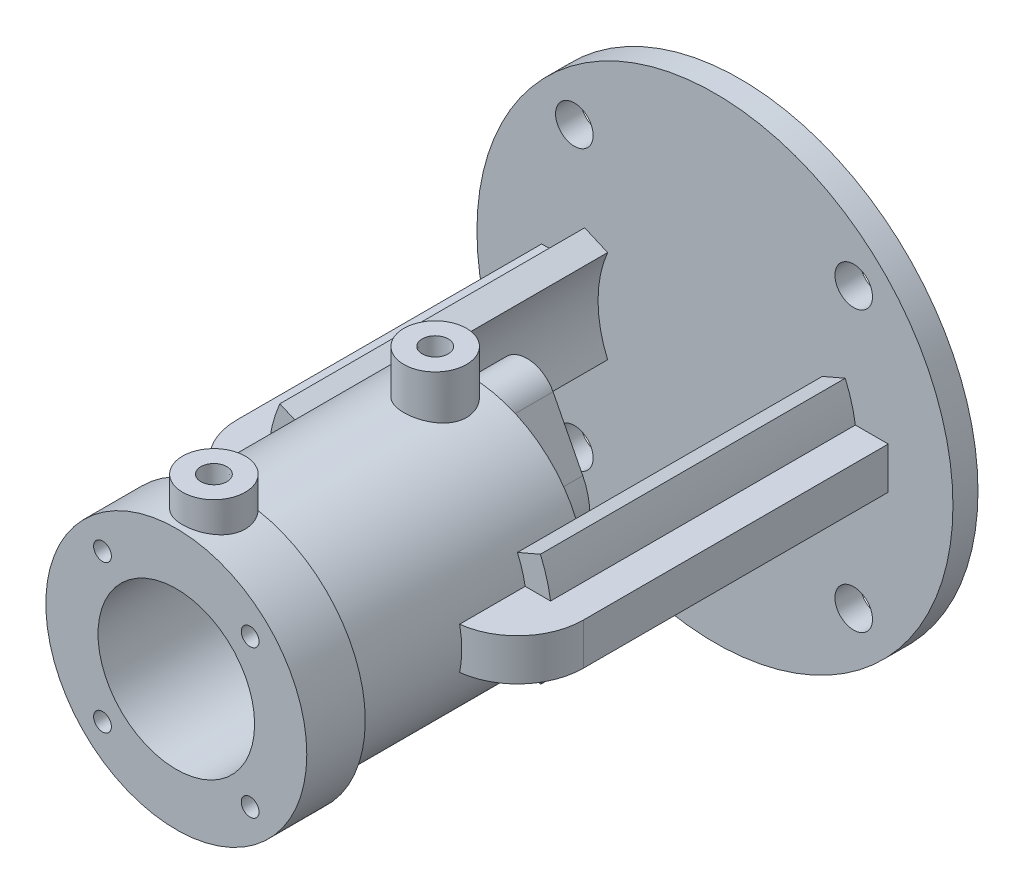
from build123d import *

# Parameters (mm, degrees)
SKETCH_1_R               = 114
EXTRUDE_1_DEPTH          = 12
EXTRUDE_START            = 258
SKETCH_2_R               = 62.5
EXTRUDE_2_DEPTH          = 28
SKETCH_3_R               = 56
EXTRUDE_3_DEPTH          = 112
SKETCH_4_R               = 30
EXTRUDE_4_DEPTH          = 28
EXTRUDE_5_REACH          = 234.843
EXTRUDE_6_DEPTH          = 118
EXTRUDE_18_DEPTH         = 28
EXTRUDE_19_DEPTH         = 10
SKETCH_12_R              = 15
EXTRUDE_20_DEPTH         = 76
SKETCH_13_R              = 15
EXTRUDE_21_DEPTH         = 76
SKETCH_14_R              = 9
CUT_EXTRUDE_1_DEPTH      = 305.230176103
PATTERN_CIRCULAR_1_COUNT = 4
SKETCH_15_R              = 62.5
EXTRUDE_22_DEPTH         = 3
SKETCH_16_R              = 37.5
CUT_EXTRUDE_2_DEPTH      = 128
PATTERN_CIRCULAR_2_COUNT = 4
SKETCH_19_R              = 41
CUT_EXTRUDE_3_DEPTH      = 8
SKETCH_20_R              = 15
EXTRUDE_23_DEPTH         = 3
CUT_EXTRUDE_4_REACH      = 220.852
SKETCH_21_R              = 12
SKETCH_22_R              = 18
CUT_EXTRUDE_5_DEPTH      = 28
CHAMFER_1_SIZE           = 6.92820323
CHAMFER_1_SIZE_2         = 4
F_1_4_RC_1_AT_2_COUNT    = 2
F_1_4_RC_1_AT_2_PITCH    = 106
F_5_0MM_START            = 11.779218889
F_5_0MM_1_OUTLINE_R      = 2.5
F_5_0MM_1_DEPTH          = 47.722932759
SKETCH_26_R              = 15
SKETCH_26_R_2            = 12
EXTRUDE_24_DEPTH         = 3


# Read off the part's stored shape, not the designer's step: Ø5.0mm 暗销孔1, M10 螺纹孔2
with BuildPart() as part:
    # 草图1 → 凸台-拉伸1 (new body)
    with BuildSketch(Plane.XY):
        Circle(SKETCH_1_R)
    extrude(amount=EXTRUDE_1_DEPTH)

    # 草图6 → 凸台-拉伸6 (add)
    with BuildSketch(Plane.XY.offset(12)):
        with BuildLine():
            Line((51.396417147, 22.235294118), (62.409935107, 27))
            ThreePointArc((62.409935107, 27), (65.390118151, 18.658307753), (67.260686883, 10))
            Line((67.260686883, 10), (83, 10))
            Line((83, 10), (83, -10))
            Line((83, -10), (67.260686883, -10))
            ThreePointArc((67.260686883, -10), (65.390118151, -18.658307753), (62.409935107, -27))
            Line((62.409935107, -27), (51.396417147, -22.235294118))
            ThreePointArc((51.396417147, -22.235294118), (56, 0), (51.396417147, 22.235294118))
        make_face()
    extrude_6 = extrude(amount=EXTRUDE_6_DEPTH)



with BuildPart() as body_2:
    # 草图2 → 凸台-拉伸2 (new body)
    with BuildSketch(Plane.XY.offset(12).offset(EXTRUDE_START)):
        Circle(SKETCH_2_R)
    extrude(amount=-EXTRUDE_2_DEPTH)

    # 草图3 → 凸台-拉伸3 (add)
    with BuildSketch(Plane(origin=(0, 0, 242), x_dir=(-1, 0, 0), z_dir=(0, 0, -1))):
        Circle(SKETCH_3_R)
    extrude(amount=EXTRUDE_3_DEPTH)

    # 草图4 → 凸台-拉伸4 (add)
    with BuildSketch(Plane(origin=(0, 0, 130), x_dir=(-1, 0, 0), z_dir=(0, 0, -1))):
        Circle(SKETCH_4_R)
    extrude(amount=EXTRUDE_4_DEPTH)

    # 草图5 → 凸台-拉伸5 (add, up to next)
    with BuildSketch(Plane(origin=(0, 0, 102), x_dir=(-1, 0, 0), z_dir=(0, 0, -1)), mode=Mode.PRIVATE) as extrude_5_sk1:
        with BuildLine():
            ThreePointArc((-26.681798428, 13.714285714), (0, 30), (26.681798428, 13.714285714))
            Line((26.681798428, 13.714285714), (12.451505933, 41.4))
            ThreePointArc((12.451505933, 41.4), (0, 49), (-12.451505933, 41.4))
            Line((-12.451505933, 41.4), (-26.681798428, 13.714285714))
        make_face()
    extrude_5_tool1 = extrude(extrude_5_sk1.sketch, amount=-EXTRUDE_5_REACH, mode=Mode.PRIVATE) - body_2.part
    # 草图5 → 凸台-拉伸5 (add, up to next)
    with BuildSketch(Plane(origin=(0, 0, 102), x_dir=(-1, 0, 0), z_dir=(0, 0, -1)), mode=Mode.PRIVATE) as extrude_5_sk2:
        with BuildLine():
            Line((12.451505933, -41.4), (26.681798428, -13.714285714))
            ThreePointArc((26.681798428, -13.714285714), (0, -30), (-26.681798428, -13.714285714))
            Line((-26.681798428, -13.714285714), (-12.451505933, -41.4))
            ThreePointArc((-12.451505933, -41.4), (0, -49), (12.451505933, -41.4))
        make_face()
    extrude_5_tool2 = extrude(extrude_5_sk2.sketch, amount=-EXTRUDE_5_REACH, mode=Mode.PRIVATE) - body_2.part
    add(extrude_5_tool1.solids().sort_by_distance((0, 35.767419, 102))[0])
    add(extrude_5_tool2.solids().sort_by_distance((0, -35.767419, 102))[0])


with BuildPart() as part_1:
    add(part.part)

    add(body_2.part)  # 凸台-拉伸18 merges body 2
    # 草图10 → 凸台-拉伸18 (add)
    with BuildSketch(Plane.XY.offset(130)):
        with BuildLine():
            Line((51.396417147, -22.235294118), (62.409935107, -27))
            ThreePointArc((62.409935107, -27), (65.390118151, -18.658307753), (67.260686883, -10))
            Line((67.260686883, -10), (83, -10))
            Line((83, -10), (83, 10))
            Line((83, 10), (67.260686883, 10))
            ThreePointArc((67.260686883, 10), (65.390118151, 18.658307753), (62.409935107, 27))
            Line((62.409935107, 27), (51.396417147, 22.235294118))
            ThreePointArc((51.396417147, 22.235294118), (56, 0), (51.396417147, -22.235294118))
        make_face()
    extrude_18 = extrude(amount=EXTRUDE_18_DEPTH)

    # 草图11 → 凸台-拉伸19 (add, symmetric)
    with BuildSketch(Plane(origin=(0, 0, 0), x_dir=(1, 0, 0), z_dir=(0, 1, 0))):
        with BuildLine():
            Line((51.396417147, -189.603582853), (51.396417147, -158))
            Line((51.396417147, -158), (83, -158))
            ThreePointArc((83, -158), (73.743524892, -180.347107745), (51.396417147, -189.603582853))
        make_face()
    extrude_19 = extrude(amount=EXTRUDE_19_DEPTH, both=True)

    # 镜向4: 凸台-拉伸6, 凸台-拉伸18, 凸台-拉伸19 across plane
    add(extrude_6.mirror(Plane(origin=(0, 0, 0), x_dir=(0, 0, 1), z_dir=(1, 0, 0))))
    add(extrude_18.mirror(Plane(origin=(0, 0, 0), x_dir=(0, 0, 1), z_dir=(1, 0, 0))))
    add(extrude_19.mirror(Plane(origin=(0, 0, 0), x_dir=(0, 0, 1), z_dir=(1, 0, 0))))

    # 草图12 → 凸台-拉伸20 (add)
    with BuildSketch(Plane(origin=(0, 0, 0), x_dir=(1, 0, 0), z_dir=(0, 1, 0))):
        with Locations(Location((0, -252, 0), (0, 0, 138.189685104))):
            Circle(SKETCH_12_R)
    extrude(amount=EXTRUDE_20_DEPTH)

    # 草图13 → 凸台-拉伸21 (add)
    with BuildSketch(Plane(origin=(0, 0, 0), x_dir=(1, 0, 0), z_dir=(0, 1, 0))):
        with Locations(Location((0, -146, 0), (0, 0, 90))):
            Circle(SKETCH_13_R)
    extrude(amount=EXTRUDE_21_DEPTH)

    # 草图14 → 切除-拉伸1 (cut, through all)
    with BuildSketch(Plane.XY.offset(12)):
        with Locations((66.468037432, -66.468037432)):
            Circle(SKETCH_14_R)
    cut_extrude_1 = extrude(amount=-CUT_EXTRUDE_1_DEPTH, mode=Mode.SUBTRACT)

    # 阵列(圆周)1: 切除-拉伸1 ×4 about axis
    pattern_circular_1_axis = Axis((-0.436506366, 0.436506366, 0), (0, 0, 1))
    for i in range(1, PATTERN_CIRCULAR_1_COUNT):
        add(cut_extrude_1.rotate(pattern_circular_1_axis, i * 360 / PATTERN_CIRCULAR_1_COUNT), mode=Mode.SUBTRACT)

    # 草图15 → 凸台-拉伸22 (add)
    with BuildSketch(Plane(origin=(0, 0, 0), x_dir=(-1, 0, 0), z_dir=(0, 0, -1))):
        with Locations(Location((0, 0, 0), (0, 0, 180))):
            Circle(SKETCH_15_R)
    extrude(amount=EXTRUDE_22_DEPTH)

    # 草图16 → 切除-拉伸2 (cut)
    with BuildSketch(Plane.XY.offset(270)):
        Circle(SKETCH_16_R)
    extrude(amount=-CUT_EXTRUDE_2_DEPTH, mode=Mode.SUBTRACT)

    # 草图18 → M10 螺纹孔1 (revolve, cut)
    with BuildSketch(Plane(origin=(35.355339059, 35.355339059, 270), x_dir=(0, -1, 0), z_dir=(1, 0, 0))):
        Polygon((0, 0), (0, 24), (4.25, 21.446342369), (4.25, 0), align=None)
    hole_wizard_m10_1 = revolve(axis=Axis((35.355339059, 35.355339059, 276.35), (0, 0, -1)), mode=Mode.SUBTRACT)

    # 阵列(圆周)2: M10 螺纹孔1 ×4 about axis
    pattern_circular_2_axis = Axis((0, 0, 0), (0, 0, 1))
    for i in range(1, PATTERN_CIRCULAR_2_COUNT):
        add(hole_wizard_m10_1.rotate(pattern_circular_2_axis, i * 360 / PATTERN_CIRCULAR_2_COUNT), mode=Mode.SUBTRACT)

    # 草图19 → 切除-拉伸3 (cut)
    with BuildSketch(Plane.XY.offset(142)):
        Circle(SKETCH_19_R)
    extrude(amount=CUT_EXTRUDE_3_DEPTH, mode=Mode.SUBTRACT)

    # 草图20 → 凸台-拉伸23 (add)
    with BuildSketch(Plane.XY.offset(142)):
        Circle(SKETCH_20_R)
    extrude(amount=EXTRUDE_23_DEPTH)

    # 草图21 → 切除-拉伸4 (cut, up to next)
    with BuildSketch(Plane.XY.offset(145), mode=Mode.PRIVATE) as cut_extrude_4_sk1:
        Circle(SKETCH_21_R)
    cut_extrude_4_tool1 = extrude(cut_extrude_4_sk1.sketch, amount=-CUT_EXTRUDE_4_REACH, mode=Mode.PRIVATE) & part_1.part
    add(cut_extrude_4_tool1.solids().sort_by_distance((0, 0, 145))[0], mode=Mode.SUBTRACT)

    # 草图22 → 切除-拉伸5 (cut)
    with BuildSketch(Plane(origin=(0, 0, 102), x_dir=(-1, 0, 0), z_dir=(0, 0, -1))):
        Circle(SKETCH_22_R)
    extrude(amount=-CUT_EXTRUDE_5_DEPTH, mode=Mode.SUBTRACT)

    # 倒角1
    # the kernel refuses this chamfer: 6.92820323, 4 mm, written as the material it takes off along each edge
    with BuildSketch(Plane(origin=(0, 0, 130), x_dir=(1, 0, 0), z_dir=(0, -1, 0))) as chamfer_1_piece_1_section:
        Polygon((12 + CHAMFER_1_SIZE, 0), (12, CHAMFER_1_SIZE_2), (12, 0), align=None)
    chamfer_1_piece_1 = revolve(axis=Axis((0, 0, 130), (0, 0, 1)), mode=Mode.PRIVATE)
    chamfer_1_piece_1 = chamfer_1_piece_1 & Plane(origin=(0, 0, 132.241387072), x_dir=(-1, 0, 0), z_dir=(0, 0, -1)) * Cylinder(18, 76, mode=Mode.PRIVATE)
    add(chamfer_1_piece_1, mode=Mode.SUBTRACT)

    # 草图24 → 1/4 Rc 螺纹孔1 (revolve, cut)
    with BuildSketch(Plane(origin=(0, 76, 252), x_dir=(0, 0, 1), z_dir=(1, 0, 0))):
        Polygon((0, 0), (0, 18), (5.35, 14.785395688), (5.35, 14), (5.810617305, 14), (6.24765, 0), align=None)
    f_1_4_rc_1 = revolve(axis=Axis((0, 82.35, 252), (0, -1, 0)), mode=Mode.SUBTRACT)

    # 1/4 Rc 螺纹孔1 at 2: 1/4 Rc 螺纹孔1 ×2
    with Locations(*[(0, 0, -i * F_1_4_RC_1_AT_2_PITCH) for i in range(1, F_1_4_RC_1_AT_2_COUNT)]):
        add(f_1_4_rc_1, mode=Mode.SUBTRACT)

    # Ø5.0mm 暗销孔1 outline → Ø5.0mm 暗销孔1 (cut)
    with BuildSketch(Plane(origin=(0, 0, 0), x_dir=(1, 0, 0), z_dir=(0, 1, 0)).offset(F_5_0MM_START)):
        with Locations((0, -252)):
            Circle(F_5_0MM_1_OUTLINE_R)
        with BuildLine():
            ThreePointArc((-2.291287847, -145), (0, -148.5), (2.291287847, -145))
            ThreePointArc((2.291287847, -145), (0, -143.5), (-2.291287847, -145))
        make_face()
    extrude(amount=F_5_0MM_1_DEPTH, mode=Mode.SUBTRACT)

    # 草图26 → 凸台-拉伸24 (add)
    with BuildSketch(Plane.XY.offset(145)):
        Circle(SKETCH_26_R)
        Circle(SKETCH_26_R_2, mode=Mode.SUBTRACT)
    extrude(amount=-EXTRUDE_24_DEPTH)

    # M10 螺纹孔2 outline → M10 螺纹孔2 (revolve, cut)
    with BuildSketch(Plane.XZ.offset(-35)):
        Polygon((4.25, 117.446342369), (0, 120), (0, 102), (4.25, 102), align=None)
    hole_wizard_m10_2 = revolve(axis=Axis((0, 35, 0), (0, 0, 1)), mode=Mode.SUBTRACT)

    # 镜向6: M10 螺纹孔2 across plane
    add(hole_wizard_m10_2.mirror(Plane.ZX), mode=Mode.SUBTRACT)


solid = part_1.part
